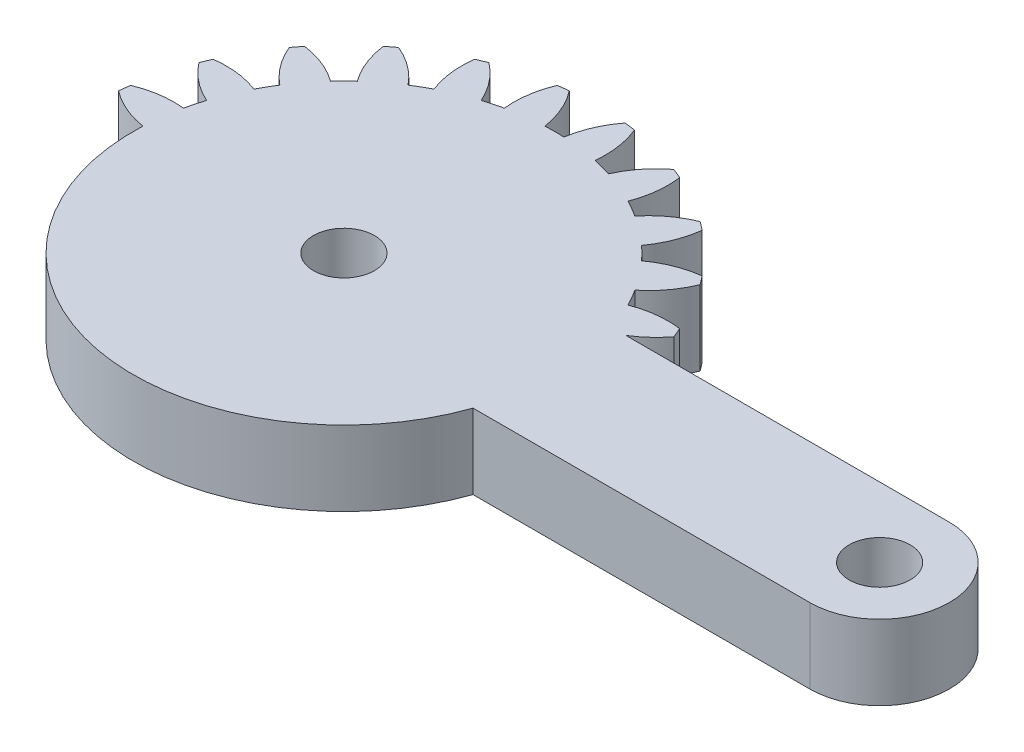
from build123d import *
from build123d.topology import SkipClean

# Parameters (mm, degrees)
SKETCH1_R           = 1.75
BOSS_EXTRUDE1_DEPTH = 4.3
CUT_EXTRUDE1_START  = -10
CUT_EXTRUDE1_DEPTH  = 10


with BuildPart() as part:
    # Sketch1 → Boss-Extrude1 (new body)
    with BuildSketch(Plane(origin=(0, 0, 0), x_dir=(1, 0, 0), z_dir=(0, 1, 0))):
        with BuildLine():
            Line((20.643657446, 4), (2.081641936, 4))
            ThreePointArc((2.081641936, 4), (2.861028333, 4.588201733), (3.521749436, 5.30713988))
            ThreePointArc((3.521749436, 5.30713988), (3.405395609, 5.596745198), (3.282888305, 5.883801663))
            ThreePointArc((3.282888305, 5.883801663), (1.93527598, 5.894040025), (0.627094961, 5.57027124))
            ThreePointArc((0.627094961, 5.57027124), (0.366286148, 6.046375), (0.084372603, 6.510293938))
            ThreePointArc((0.084372603, 6.510293938), (1.018855105, 7.48132754), (1.683794586, 8.65351323))
            ThreePointArc((1.683794586, 8.65351323), (1.496450048, 8.903135899), (1.303821399, 9.148703928))
            ThreePointArc((1.303821399, 9.148703928), (-0.000522033, 8.809805691), (-1.180330337, 8.158486898))
            ThreePointArc((-1.180330337, 8.158486898), (-1.555477026, 8.550865528), (-1.947855656, 8.926012217))
            ThreePointArc((-1.947855656, 8.926012217), (-1.296536862, 10.105820521), (-0.957638625, 11.410163953))
            ThreePointArc((-0.957638625, 11.410163953), (-1.203206655, 11.602792602), (-1.452829324, 11.79013714))
            ThreePointArc((-1.452829324, 11.79013714), (-2.625015014, 11.125197659), (-3.596048616, 10.190715157))
            ThreePointArc((-3.596048616, 10.190715157), (-4.059967554, 10.472628702), (-4.536071314, 10.733437515))
            ThreePointArc((-4.536071314, 10.733437515), (-4.212302529, 12.041618533), (-4.222540891, 13.389230859))
            ThreePointArc((-4.222540891, 13.389230859), (-4.509597355, 13.511738163), (-4.799202674, 13.62809199))
            ThreePointArc((-4.799202674, 13.62809199), (-5.759348103, 12.682425791), (-6.455432668, 11.528463019))
            ThreePointArc((-6.455432668, 11.528463019), (-6.976508546, 11.680699536), (-7.503891752, 11.809396783))
            ThreePointArc((-7.503891752, 11.809396783), (-7.529737283, 13.156800143), (-7.888414517, 14.455843809))
            ThreePointArc((-7.888414517, 14.455843809), (-8.197396993, 14.499881098), (-8.507248835, 14.537314892))
            ThreePointArc((-8.507248835, 14.537314892), (-9.18992168, 13.375367565), (-9.563620196, 12.080565177))
            ThreePointArc((-9.563620196, 12.080565177), (-10.106342554, 12.09275), (-10.649064912, 12.080565177))
            ThreePointArc((-10.649064912, 12.080565177), (-11.022763428, 13.375367565), (-11.705436272, 14.537314892))
            ThreePointArc((-11.705436272, 14.537314892), (-12.015288115, 14.499881098), (-12.324270591, 14.455843809))
            ThreePointArc((-12.324270591, 14.455843809), (-12.682947825, 13.156800143), (-12.708793355, 11.809396783))
            ThreePointArc((-12.708793355, 11.809396783), (-13.236176561, 11.680699536), (-13.757252439, 11.528463019))
            ThreePointArc((-13.757252439, 11.528463019), (-14.453337005, 12.682425791), (-15.413482434, 13.62809199))
            ThreePointArc((-15.413482434, 13.62809199), (-15.703087752, 13.511738163), (-15.990144217, 13.389230859))
            ThreePointArc((-15.990144217, 13.389230859), (-16.000382579, 12.041618533), (-15.676613793, 10.733437515))
            ThreePointArc((-15.676613793, 10.733437515), (-16.152717554, 10.472628702), (-16.616636492, 10.190715157))
            ThreePointArc((-16.616636492, 10.190715157), (-17.587670094, 11.125197659), (-18.759855783, 11.79013714))
            ThreePointArc((-18.759855783, 11.79013714), (-19.009478453, 11.602792602), (-19.255046482, 11.410163953))
            ThreePointArc((-19.255046482, 11.410163953), (-18.916148245, 10.105820521), (-18.264829452, 8.926012217))
            ThreePointArc((-18.264829452, 8.926012217), (-18.657208082, 8.550865528), (-19.032354771, 8.158486898))
            ThreePointArc((-19.032354771, 8.158486898), (-20.212163074, 8.809805691), (-21.516506507, 9.148703928))
            ThreePointArc((-21.516506507, 9.148703928), (-21.709135156, 8.903135899), (-21.896479694, 8.65351323))
            ThreePointArc((-21.896479694, 8.65351323), (-21.231540213, 7.48132754), (-20.297057711, 6.510293938))
            ThreePointArc((-20.297057711, 6.510293938), (-20.578971255, 6.046375), (-20.839780068, 5.57027124))
            ThreePointArc((-20.839780068, 5.57027124), (-22.147961087, 5.894040025), (-23.495573413, 5.883801663))
            ThreePointArc((-23.495573413, 5.883801663), (-23.618080717, 5.596745198), (-23.734434544, 5.30713988))
            ThreePointArc((-23.734434544, 5.30713988), (-22.788768345, 4.346994451), (-21.634805572, 3.650909885))
            ThreePointArc((-21.634805572, 3.650909885), (-21.78704209, 3.129834008), (-21.915739337, 2.602450802))
            ThreePointArc((-21.915739337, 2.602450802), (-23.263142697, 2.576605271), (-24.562186363, 2.217928037))
            ThreePointArc((-24.562186363, 2.217928037), (-24.606223651, 1.908945561), (-24.643657446, 1.599093719))
            ThreePointArc((-24.643657446, 1.599093719), (-23.481710119, 0.916420874), (-22.186907731, 0.542722358))
            ThreePointArc((-22.186907731, 0.542722358), (-22.199092554, 0), (-22.186907731, -0.542722358))
            ThreePointArc((-22.186907731, -0.542722358), (-23.481710119, -0.916420874), (-24.643657446, -1.599093719))
            ThreePointArc((-24.643657446, -1.599093719), (-24.606223651, -1.908945561), (-24.562186363, -2.217928037))
            ThreePointArc((-24.562186363, -2.217928037), (-23.263142697, -2.576605271), (-21.915739337, -2.602450802))
            ThreePointArc((-21.915739337, -2.602450802), (-21.78704209, -3.129834008), (-21.634805572, -3.650909885))
            ThreePointArc((-21.634805572, -3.650909885), (-22.788768345, -4.346994451), (-23.734434544, -5.30713988))
            ThreePointArc((-23.734434544, -5.30713988), (-23.618080717, -5.596745198), (-23.495573413, -5.883801663))
            ThreePointArc((-23.495573413, -5.883801663), (-22.147961087, -5.894040025), (-20.839780068, -5.57027124))
            ThreePointArc((-20.839780068, -5.57027124), (-20.578971255, -6.046375), (-20.297057711, -6.510293938))
            ThreePointArc((-20.297057711, -6.510293938), (-21.231540213, -7.48132754), (-21.896479694, -8.65351323))
            ThreePointArc((-21.896479694, -8.65351323), (-21.709135156, -8.903135899), (-21.516506507, -9.148703928))
            ThreePointArc((-21.516506507, -9.148703928), (-20.212163074, -8.809805691), (-19.032354771, -8.158486898))
            ThreePointArc((-19.032354771, -8.158486898), (-18.657208082, -8.550865528), (-18.264829452, -8.926012217))
            ThreePointArc((-18.264829452, -8.926012217), (-18.916148245, -10.105820521), (-19.255046482, -11.410163953))
            ThreePointArc((-19.255046482, -11.410163953), (-19.009478453, -11.602792602), (-18.759855783, -11.79013714))
            ThreePointArc((-18.759855783, -11.79013714), (-17.587670094, -11.125197659), (-16.616636492, -10.190715157))
            ThreePointArc((-16.616636492, -10.190715157), (-16.152717554, -10.472628702), (-15.676613793, -10.733437515))
            ThreePointArc((-15.676613793, -10.733437515), (-16.000382579, -12.041618533), (-15.990144217, -13.389230859))
            ThreePointArc((-15.990144217, -13.389230859), (-15.703087752, -13.511738163), (-15.413482434, -13.62809199))
            ThreePointArc((-15.413482434, -13.62809199), (-14.453337005, -12.682425791), (-13.757252439, -11.528463019))
            ThreePointArc((-13.757252439, -11.528463019), (-13.236176561, -11.680699536), (-12.708793355, -11.809396783))
            ThreePointArc((-12.708793355, -11.809396783), (-12.682947825, -13.156800143), (-12.324270591, -14.455843809))
            ThreePointArc((-12.324270591, -14.455843809), (-12.015288115, -14.499881098), (-11.705436272, -14.537314892))
            ThreePointArc((-11.705436272, -14.537314892), (-11.022763428, -13.375367565), (-10.649064912, -12.080565177))
            ThreePointArc((-10.649064912, -12.080565177), (-10.106342554, -12.09275), (-9.563620196, -12.080565177))
            ThreePointArc((-9.563620196, -12.080565177), (-9.18992168, -13.375367565), (-8.507248835, -14.537314892))
            ThreePointArc((-8.507248835, -14.537314892), (-8.197396993, -14.499881098), (-7.888414517, -14.455843809))
            ThreePointArc((-7.888414517, -14.455843809), (-7.529737283, -13.156800143), (-7.503891752, -11.809396783))
            ThreePointArc((-7.503891752, -11.809396783), (-6.976508546, -11.680699536), (-6.455432668, -11.528463019))
            ThreePointArc((-6.455432668, -11.528463019), (-5.759348103, -12.682425791), (-4.799202674, -13.62809199))
            ThreePointArc((-4.799202674, -13.62809199), (-4.509597355, -13.511738163), (-4.222540891, -13.389230859))
            ThreePointArc((-4.222540891, -13.389230859), (-4.212302529, -12.041618533), (-4.536071314, -10.733437515))
            ThreePointArc((-4.536071314, -10.733437515), (-4.059967554, -10.472628702), (-3.596048616, -10.190715157))
            ThreePointArc((-3.596048616, -10.190715157), (-2.625015014, -11.125197659), (-1.452829324, -11.79013714))
            ThreePointArc((-1.452829324, -11.79013714), (-1.203206655, -11.602792602), (-0.957638625, -11.410163953))
            ThreePointArc((-0.957638625, -11.410163953), (-1.296536862, -10.105820521), (-1.947855656, -8.926012217))
            ThreePointArc((-1.947855656, -8.926012217), (-1.555477026, -8.550865528), (-1.180330337, -8.158486898))
            ThreePointArc((-1.180330337, -8.158486898), (-0.000522033, -8.809805691), (1.303821399, -9.148703928))
            ThreePointArc((1.303821399, -9.148703928), (1.496450048, -8.903135899), (1.683794586, -8.65351323))
            ThreePointArc((1.683794586, -8.65351323), (1.018855105, -7.48132754), (0.084372603, -6.510293938))
            ThreePointArc((0.084372603, -6.510293938), (0.366286148, -6.046375), (0.627094961, -5.57027124))
            ThreePointArc((0.627094961, -5.57027124), (1.93527598, -5.894040025), (3.282888305, -5.883801663))
            ThreePointArc((3.282888305, -5.883801663), (3.405395609, -5.596745198), (3.521749436, -5.30713988))
            ThreePointArc((3.521749436, -5.30713988), (2.861028333, -4.588201733), (2.081641936, -4))
            Line((2.081641936, -4), (20.643657446, -4))
            ThreePointArc((20.643657446, -4), (24.643657446, 0), (20.643657446, 4))
        make_face()
        with Locations((-10.106342554, 0)):
            Circle(SKETCH1_R, mode=Mode.SUBTRACT)
        with Locations((20.643657446, 0)):
            Circle(SKETCH1_R, mode=Mode.SUBTRACT)
    extrude(amount=BOSS_EXTRUDE1_DEPTH)

    # Sketch2 → Cut-Extrude1 (cut)
    with SkipClean():  # the faces are left unmerged after this step: merging them gives an invalid solid
        with BuildSketch(Plane(origin=(0, 4.3, 0), x_dir=(1, 0, 0), z_dir=(0, 1, 0)).offset(CUT_EXTRUDE1_START)):
            with BuildLine():
                ThreePointArc((3.521749436, -5.30713988), (2.861028333, -4.588201733), (2.081641936, -4))
                Line((2.081641936, -4), (1.305695063, -4))
                ThreePointArc((1.305695063, -4), (0.994195953, -4.797149927), (0.627094961, -5.57027124))
                ThreePointArc((0.627094961, -5.57027124), (1.93527598, -5.894040025), (3.282888305, -5.883801663))
                ThreePointArc((3.282888305, -5.883801663), (3.405395609, -5.596745198), (3.521749436, -5.30713988))
            make_face()
            with BuildLine():
                ThreePointArc((1.683794586, -8.65351323), (1.018855105, -7.48132754), (0.084372603, -6.510293938))
                ThreePointArc((0.084372603, -6.510293938), (-0.512518948, -7.361599771), (-1.180330337, -8.158486898))
                ThreePointArc((-1.180330337, -8.158486898), (-0.000522033, -8.809805691), (1.303821399, -9.148703928))
                ThreePointArc((1.303821399, -9.148703928), (1.496450048, -8.903135899), (1.683794586, -8.65351323))
            make_face()
            with BuildLine():
                ThreePointArc((-0.957638625, -11.410163953), (-1.296536862, -10.105820521), (-1.947855656, -8.926012217))
                ThreePointArc((-1.947855656, -8.926012217), (-2.744742783, -9.593823606), (-3.596048616, -10.190715157))
                ThreePointArc((-3.596048616, -10.190715157), (-2.625015014, -11.125197659), (-1.452829324, -11.79013714))
                ThreePointArc((-1.452829324, -11.79013714), (-1.203206655, -11.602792602), (-0.957638625, -11.410163953))
            make_face()
            with BuildLine():
                ThreePointArc((-4.222540891, -13.389230859), (-4.212302529, -12.041618533), (-4.536071314, -10.733437515))
                ThreePointArc((-4.536071314, -10.733437515), (-5.478647477, -11.172244217), (-6.455432668, -11.528463019))
                ThreePointArc((-6.455432668, -11.528463019), (-5.759348103, -12.682425791), (-4.799202674, -13.62809199))
                ThreePointArc((-4.799202674, -13.62809199), (-4.509597355, -13.511738163), (-4.222540891, -13.389230859))
            make_face()
            with BuildLine():
                ThreePointArc((-7.888414517, -14.455843809), (-7.529737283, -13.156800143), (-7.503891752, -11.809396783))
                ThreePointArc((-7.503891752, -11.809396783), (-8.527921943, -11.989294847), (-9.563620196, -12.080565177))
                ThreePointArc((-9.563620196, -12.080565177), (-9.18992168, -13.375367565), (-8.507248835, -14.537314892))
                ThreePointArc((-8.507248835, -14.537314892), (-8.197396993, -14.499881098), (-7.888414517, -14.455843809))
            make_face()
            with BuildLine():
                ThreePointArc((-11.705436272, -14.537314892), (-11.022763428, -13.375367565), (-10.649064912, -12.080565177))
                ThreePointArc((-10.649064912, -12.080565177), (-11.684763165, -11.989294847), (-12.708793355, -11.809396783))
                ThreePointArc((-12.708793355, -11.809396783), (-12.682947825, -13.156800143), (-12.324270591, -14.455843809))
                ThreePointArc((-12.324270591, -14.455843809), (-12.015288115, -14.499881098), (-11.705436272, -14.537314892))
            make_face()
            with BuildLine():
                ThreePointArc((-15.413482434, -13.62809199), (-14.453337005, -12.682425791), (-13.757252439, -11.528463019))
                ThreePointArc((-13.757252439, -11.528463019), (-14.734037631, -11.172244217), (-15.676613793, -10.733437515))
                ThreePointArc((-15.676613793, -10.733437515), (-16.000382579, -12.041618533), (-15.990144217, -13.389230859))
                ThreePointArc((-15.990144217, -13.389230859), (-15.703087752, -13.511738163), (-15.413482434, -13.62809199))
            make_face()
            with BuildLine():
                ThreePointArc((-18.759855783, -11.79013714), (-17.587670094, -11.125197659), (-16.616636492, -10.190715157))
                ThreePointArc((-16.616636492, -10.190715157), (-17.467942324, -9.593823606), (-18.264829452, -8.926012217))
                ThreePointArc((-18.264829452, -8.926012217), (-18.916148245, -10.105820521), (-19.255046482, -11.410163953))
                ThreePointArc((-19.255046482, -11.410163953), (-19.009478453, -11.602792602), (-18.759855783, -11.79013714))
            make_face()
            with BuildLine():
                ThreePointArc((-21.516506507, -9.148703928), (-20.212163074, -8.809805691), (-19.032354771, -8.158486898))
                ThreePointArc((-19.032354771, -8.158486898), (-19.70016616, -7.361599771), (-20.297057711, -6.510293938))
                ThreePointArc((-20.297057711, -6.510293938), (-21.231540213, -7.48132754), (-21.896479694, -8.65351323))
                ThreePointArc((-21.896479694, -8.65351323), (-21.709135156, -8.903135899), (-21.516506507, -9.148703928))
            make_face()
            with BuildLine():
                ThreePointArc((-23.495573413, -5.883801663), (-22.147961087, -5.894040025), (-20.839780068, -5.57027124))
                ThreePointArc((-20.839780068, -5.57027124), (-21.278586771, -4.627695077), (-21.634805572, -3.650909885))
                ThreePointArc((-21.634805572, -3.650909885), (-22.788768345, -4.346994451), (-23.734434544, -5.30713988))
                ThreePointArc((-23.734434544, -5.30713988), (-23.618080717, -5.596745198), (-23.495573413, -5.883801663))
            make_face()
            with BuildLine():
                ThreePointArc((-24.562186363, -2.217928037), (-23.263142697, -2.576605271), (-21.915739337, -2.602450802))
                ThreePointArc((-21.915739337, -2.602450802), (-22.095637401, -1.578420611), (-22.186907731, -0.542722358))
                ThreePointArc((-22.186907731, -0.542722358), (-23.481710119, -0.916420874), (-24.643657446, -1.599093719))
                ThreePointArc((-24.643657446, -1.599093719), (-24.606223651, -1.908945561), (-24.562186363, -2.217928037))
            make_face()
        extrude(amount=CUT_EXTRUDE1_DEPTH, mode=Mode.SUBTRACT)


solid = part.part
